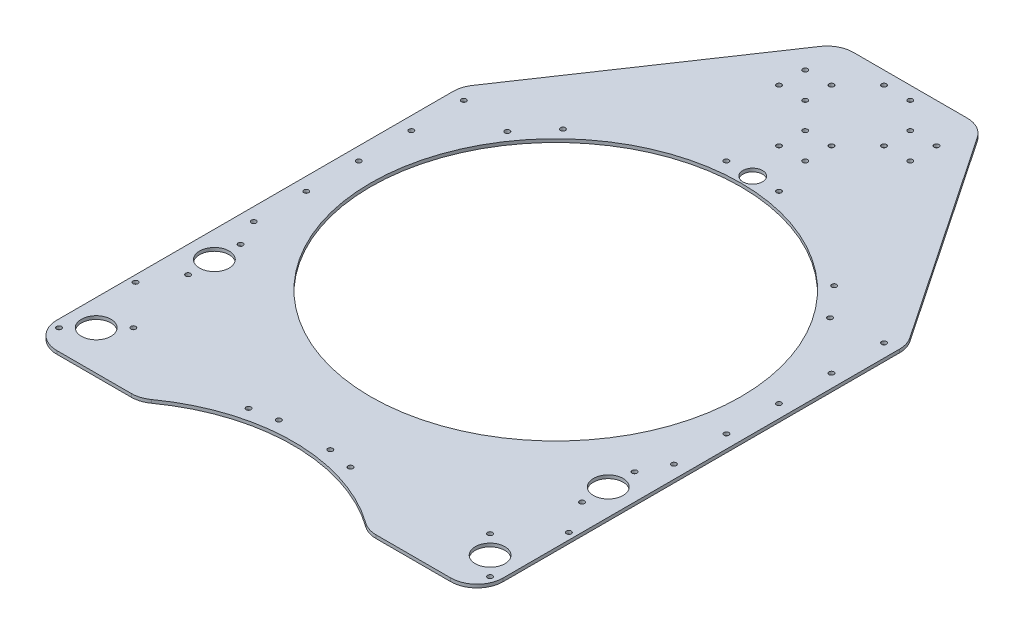
from build123d import *

# Parameters (mm, degrees)
SKETCH1_W           = 431.8
SKETCH1_H           = 685.8
BOSS_EXTRUDE1_DEPTH = 3.175
SKETCH2_R           = 14.3129
SKETCH2_R_2         = 2.38125
CUT_EXTRUDE1_DEPTH  = 406.22006444
SKETCH6_R           = 179.07
CUT_EXTRUDE4_DEPTH  = 406.22006444
SKETCH8_R           = 9.525
SKETCH8_R_2         = 2.38125
CUT_EXTRUDE6_DEPTH  = 406.22006444
FILLET2_R           = 25.4
SKETCH11_R          = 2.38125
CUT_EXTRUDE9_DEPTH  = 406.22006444
SKETCH13_R          = 2.38125
SKETCH13_R_2        = 2.466421692
SKETCH13_R_3        = 2.307769972
CUT_EXTRUDE10_DEPTH = 406.22006444
SKETCH14_R          = 2.38125
CUT_EXTRUDE11_DEPTH = 406.22006444
SKETCH16_W          = 431.8
SKETCH16_H          = 50.8
CUT_EXTRUDE13_DEPTH = 406.22006444
SKETCH17_R          = 177.8
SKETCH17_R_2        = 2.38125
CUT_EXTRUDE14_DEPTH = 406.22006444
FILLET3_R           = 25.4
SKETCH18_R          = 2.38125
CUT_EXTRUDE15_DEPTH = 406.22006444
CHAMFER1_SIZE       = 147.32
CHAMFER1_SIZE2      = 218.410881881
CHAMFER2_SIZE       = 147.32
CHAMFER2_SIZE2      = 218.410881881
FILLET4_R           = 25.4


with BuildPart() as part:
    # Sketch1 → Boss-Extrude1 (new body)
    with BuildSketch(Plane(origin=(0, 0, 0), x_dir=(1, 0, 0), z_dir=(0, 1, 0))):
        Rectangle(SKETCH1_W, SKETCH1_H)
    extrude(amount=BOSS_EXTRUDE1_DEPTH)

    # Sketch2 → Cut-Extrude1 (cut, through all)
    with BuildSketch(Plane(origin=(0, 3.175, 0), x_dir=(1, 0, 0), z_dir=(0, 1, 0))):
        with Locations((-190.5, -304.8)):
            Circle(SKETCH2_R)
        with Locations((-190.5, -190.5)):
            Circle(SKETCH2_R)
        with Locations((190.5, -190.5)):
            Circle(SKETCH2_R)
        with Locations((190.5, -215.9)):
            Circle(SKETCH2_R_2)
        with Locations((190.5, -165.1)):
            Circle(SKETCH2_R_2)
        with Locations((-190.5, -215.9)):
            Circle(SKETCH2_R_2)
        with Locations((-190.5, -165.1)):
            Circle(SKETCH2_R_2)
        with Locations((-208.460512242, -322.760512242)):
            Circle(SKETCH2_R_2)
        with Locations((-172.539487758, -286.839487758)):
            Circle(SKETCH2_R_2)
        with Locations((172.539487758, -286.839487758)):
            Circle(SKETCH2_R_2)
        with Locations((208.460512242, -322.760512242)):
            Circle(SKETCH2_R_2)
        with Locations((190.5, -304.8)):
            Circle(SKETCH2_R)
    extrude(amount=-CUT_EXTRUDE1_DEPTH, mode=Mode.SUBTRACT)

    # Sketch6 → Cut-Extrude4 (cut, through all)
    with BuildSketch(Plane(origin=(0, 3.175, 0), x_dir=(1, 0, 0), z_dir=(0, 1, 0))):
        with Locations((0, -50.8)):
            Circle(SKETCH6_R)
    extrude(amount=-CUT_EXTRUDE4_DEPTH, mode=Mode.SUBTRACT)

    # Sketch8 → Cut-Extrude6 (cut, through all)
    with BuildSketch(Plane(origin=(0, 3.175, 0), x_dir=(1, 0, 0), z_dir=(0, 1, 0))):
        with Locations((0, 139.7)):
            Circle(SKETCH8_R)
        with Locations((25.4, 139.7)):
            Circle(SKETCH8_R_2)
        with Locations((-25.4, 139.7)):
            Circle(SKETCH8_R_2)
    extrude(amount=-CUT_EXTRUDE6_DEPTH, mode=Mode.SUBTRACT)

    # Fillet2
    fillet2_edges = [part.edges().sort_by_distance(p)[0] for p in [
        (215.9, 1.5875, 342.9),
        (-215.9, 1.5875, 342.9),
    ]]
    fillet(fillet2_edges, radius=FILLET2_R)

    # Sketch11 → Cut-Extrude9 (cut, through all)
    with BuildSketch(Plane(origin=(0, 3.175, 0), x_dir=(1, 0, 0), z_dir=(0, 1, 0))):
        with Locations((156.048464437, 58.466311125)):
            Circle(SKETCH11_R)
        with Locations((131.183773775, 87.334237241)):
            Circle(SKETCH11_R)
        with Locations((-131.183773775, 87.334237241)):
            Circle(SKETCH11_R)
        with Locations((-156.048464437, 58.466311125)):
            Circle(SKETCH11_R)
    extrude(amount=-CUT_EXTRUDE9_DEPTH, mode=Mode.SUBTRACT)

    # Sketch13 → Cut-Extrude10 (cut, through all)
    with BuildSketch(Plane(origin=(0, 3.175, 0), x_dir=(1, 0, 0), z_dir=(0, 1, 0))):
        with Locations((-203.2, 317.5)):
            Circle(SKETCH13_R)
        with Locations((-203.2, 266.7)):
            Circle(SKETCH13_R)
        with Locations((-203.2, 215.9)):
            Circle(SKETCH13_R)
        with Locations((-203.2, 165.1)):
            Circle(SKETCH13_R)
        with Locations((-203.2, 114.3)):
            Circle(SKETCH13_R)
        with Locations((-203.2, 63.5)):
            Circle(SKETCH13_R)
        with Locations((-203.2, 12.7)):
            Circle(SKETCH13_R)
        with Locations((-203.2, -38.1)):
            Circle(SKETCH13_R)
        with Locations((-203.2, -88.9)):
            Circle(SKETCH13_R)
        with Locations((-203.2, -139.7)):
            Circle(SKETCH13_R)
        with Locations((203.2, -139.7)):
            Circle(SKETCH13_R)
        with Locations((203.2, 12.7)):
            Circle(SKETCH13_R)
        with Locations((203.2, 63.5)):
            Circle(SKETCH13_R)
        with Locations((203.2, 114.3)):
            Circle(SKETCH13_R)
        with Locations((203.2, 165.1)):
            Circle(SKETCH13_R)
        with Locations((203.2, 266.7)):
            Circle(SKETCH13_R)
        with Locations((203.2, 317.5)):
            Circle(SKETCH13_R)
        with Locations((-25.4, -330.2)):
            Circle(SKETCH13_R_2)
        with Locations((-50.8, -330.2)):
            Circle(SKETCH13_R_3)
        with Locations((50.8, -330.2)):
            Circle(SKETCH13_R_3)
        with Locations((25.4, -330.2)):
            Circle(SKETCH13_R_2)
        with Locations((203.2, -88.9)):
            Circle(SKETCH13_R)
        with Locations((203.2, -38.1)):
            Circle(SKETCH13_R)
        with Locations((203.2, 215.9)):
            Circle(SKETCH13_R)
    extrude(amount=-CUT_EXTRUDE10_DEPTH, mode=Mode.SUBTRACT)

    # Sketch14 → Cut-Extrude11 (cut, through all)
    with BuildSketch(Plane(origin=(0, 3.175, 0), x_dir=(1, 0, 0), z_dir=(0, 1, 0))):
        with Locations((209.55, -247.65)):
            Circle(SKETCH14_R)
        with Locations((-209.55, -247.65)):
            Circle(SKETCH14_R)
    extrude(amount=-CUT_EXTRUDE11_DEPTH, mode=Mode.SUBTRACT)

    # Sketch16 → Cut-Extrude13 (cut, through all)
    with BuildSketch(Plane(origin=(0, 3.175, 0), x_dir=(1, 0, 0), z_dir=(0, 1, 0))):
        with Locations((0, 317.5)):
            Rectangle(SKETCH16_W, SKETCH16_H)
    extrude(amount=-CUT_EXTRUDE13_DEPTH, mode=Mode.SUBTRACT)

    # Sketch17 → Cut-Extrude14 (cut, through all)
    with BuildSketch(Plane(origin=(0, 0, 0), x_dir=(-1, 0, 0), z_dir=(0, -1, 0))):
        with Locations((0, -482.6)):
            Circle(SKETCH17_R)
        with Locations((24.865239618, -293.729753908)):
            Circle(SKETCH17_R_2)
        with Locations((49.305028092, -298.591130092)):
            Circle(SKETCH17_R_2)
        with Locations((-24.865239618, -293.729753908)):
            Circle(SKETCH17_R_2)
        with Locations((-49.305028092, -298.591130092)):
            Circle(SKETCH17_R_2)
    extrude(amount=-CUT_EXTRUDE14_DEPTH, mode=Mode.SUBTRACT)

    # Fillet3
    fillet3_edges = [part.edges().sort_by_distance(p)[0] for p in [
        (109.985226281, 1.5875, 342.9),
        (-109.985226281, 1.5875, 342.9),
    ]]
    fillet(fillet3_edges, radius=FILLET3_R)

    # Sketch18 → Cut-Extrude15 (cut, through all)
    with BuildSketch(Plane(origin=(0, 3.175, 0), x_dir=(1, 0, 0), z_dir=(0, 1, 0))):
        with Locations((38.1, 228.6)):
            Circle(SKETCH18_R)
        with Locations((63.5, 228.6)):
            Circle(SKETCH18_R)
        with Locations((63.5, 254)):
            Circle(SKETCH18_R)
        with Locations((38.1, 254)):
            Circle(SKETCH18_R)
        with Locations((-12.7, 177.8)):
            Circle(SKETCH18_R)
        with Locations((-12.7, 203.2)):
            Circle(SKETCH18_R)
        with Locations((12.7, 177.8)):
            Circle(SKETCH18_R)
        with Locations((12.7, 203.2)):
            Circle(SKETCH18_R)
        with Locations((-63.5, 254)):
            Circle(SKETCH18_R)
        with Locations((-38.1, 254)):
            Circle(SKETCH18_R)
        with Locations((-63.5, 228.6)):
            Circle(SKETCH18_R)
        with Locations((-38.1, 228.6)):
            Circle(SKETCH18_R)
        with Locations((12.7, 304.8)):
            Circle(SKETCH18_R)
        with Locations((12.7, 279.4)):
            Circle(SKETCH18_R)
        with Locations((-12.7, 304.8)):
            Circle(SKETCH18_R)
        with Locations((-12.7, 279.4)):
            Circle(SKETCH18_R)
    extrude(amount=-CUT_EXTRUDE15_DEPTH, mode=Mode.SUBTRACT)

    # Chamfer1
    chamfer1_edges = [part.edges().sort_by_distance(p)[0] for p in [
        (215.9, 1.5875, -292.1),
    ]]
    chamfer1_side = [part.faces().sort_by_distance(p)[0] for p in [
        (0, 1.5875, -292.1),
    ]]
    chamfer(chamfer1_edges, length=CHAMFER1_SIZE, length2=CHAMFER1_SIZE2, reference=chamfer1_side[0])

    # Chamfer2
    chamfer2_edges = [part.edges().sort_by_distance(p)[0] for p in [
        (-215.9, 1.5875, -292.1),
    ]]
    chamfer2_side = [part.faces().sort_by_distance(p)[0] for p in [
        (-73.66, 1.5875, -292.1),
    ]]
    chamfer(chamfer2_edges, length=CHAMFER2_SIZE, length2=CHAMFER2_SIZE2, reference=chamfer2_side[0])

    # Fillet4
    fillet4_edges = [part.edges().sort_by_distance(p)[0] for p in [
        (68.58, 1.5875, -292.1),
        (-68.58, 1.5875, -292.1),
        (-215.9, 1.5875, -73.689118119),
        (215.9, 1.5875, -73.689118119),
    ]]
    fillet(fillet4_edges, radius=FILLET4_R)


solid = part.part
